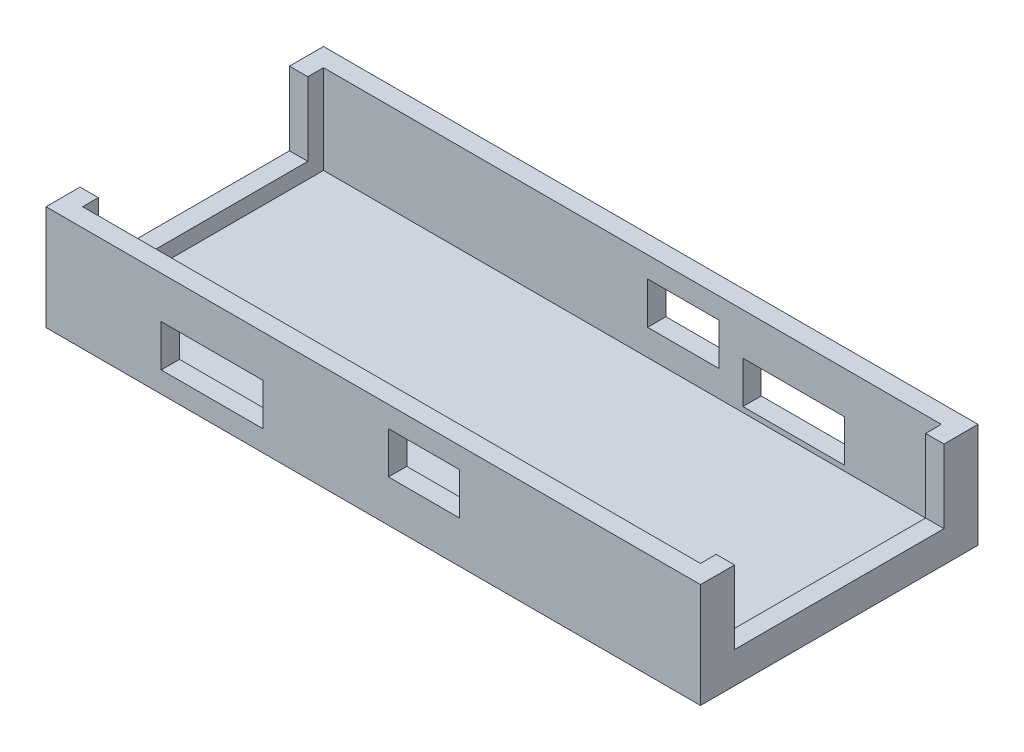
from build123d import *

# Parameters (mm, degrees)
CROQUIS1_W              = 62.5
CROQUIS1_H              = 26.5
SALIENTE_EXTRUIR1_DEPTH = 10
CORTAR_EXTRUIR1_START   = 10
CROQUIS2_W              = 59
CROQUIS2_H              = 23
CORTAR_EXTRUIR1_DEPTH   = 8.5
CORTAR_EXTRUIR4_START   = 13.25
CROQUIS6_W              = 6.8
CROQUIS6_H              = 4
CORTAR_EXTRUIR4_DEPTH   = 40
CORTAR_EXTRUIR5_START   = 13.25
CROQUIS7_W              = 9.7
CROQUIS7_H              = 4
CORTAR_EXTRUIR5_DEPTH   = 11
CROQUIS10_W             = 9.7
CROQUIS10_H             = 4
CORTAR_EXTRUIR6_DEPTH   = 11
CROQUIS11_W             = 14
CROQUIS11_H             = 11
SALIENTE_EXTRUIR2_DEPTH = 2
CROQUIS12_W             = 10
CROQUIS12_H             = 1.25
CORTAR_EXTRUIR7_DEPTH   = 22
REDONDEO1_R             = 0.5
CORTAR_EXTRUIR8_START   = 31.25
CROQUIS4_W              = 20
CROQUIS4_H              = 7
CORTAR_EXTRUIR8_DEPTH   = 10
CORTAR_EXTRUIR9_START   = -31.25
CROQUIS4_3_W            = 20
CROQUIS4_3_H            = 7
CORTAR_EXTRUIR9_DEPTH   = 10


with BuildPart() as part:
    # Croquis1 → Saliente-Extruir1 (new body)
    with BuildSketch(Plane(origin=(0, 0, 0), x_dir=(1, 0, 0), z_dir=(0, 1, 0))):
        Rectangle(CROQUIS1_W, CROQUIS1_H)
    extrude(amount=SALIENTE_EXTRUIR1_DEPTH)

    # Croquis2 → Cortar-Extruir1 (cut)
    with BuildSketch(Plane(origin=(0, 0, 0), x_dir=(1, 0, 0), z_dir=(0, 1, 0)).offset(CORTAR_EXTRUIR1_START)):
        Rectangle(CROQUIS2_W, CROQUIS2_H)
    extrude(amount=-CORTAR_EXTRUIR1_DEPTH, mode=Mode.SUBTRACT)

    # Croquis6 → Cortar-Extruir4 (cut)
    with BuildSketch(Plane.XY.offset(CORTAR_EXTRUIR4_START)):
        with Locations((4.85, 6)):
            Rectangle(CROQUIS6_W, CROQUIS6_H)
    extrude(amount=-CORTAR_EXTRUIR4_DEPTH, mode=Mode.SUBTRACT)

    # Croquis7 → Cortar-Extruir5 (cut)
    with BuildSketch(Plane.XY.offset(CORTAR_EXTRUIR5_START)):
        with Locations((-15.4, 4)):
            Rectangle(CROQUIS7_W, CROQUIS7_H)
    extrude(amount=-CORTAR_EXTRUIR5_DEPTH, mode=Mode.SUBTRACT)

    # Croquis10 → Cortar-Extruir6 (cut)
    with BuildSketch(Plane(origin=(0, 0, -13.25), x_dir=(-1, 0, 0), z_dir=(0, 0, -1))):
        with Locations((-15.4, 4)):
            Rectangle(CROQUIS10_W, CROQUIS10_H)
    extrude(amount=-CORTAR_EXTRUIR6_DEPTH, mode=Mode.SUBTRACT)

    # Croquis11 → Saliente-Extruir2 (add)
    with BuildSketch(Plane(origin=(0, 0, 0), x_dir=(-1, 0, 0), z_dir=(0, -1, 0))):
        with Locations((-14.25, 0)):
            Rectangle(CROQUIS11_W, CROQUIS11_H)
        with Locations((14.25, 0)):
            Rectangle(CROQUIS11_W, CROQUIS11_H)
    extrude(amount=SALIENTE_EXTRUIR2_DEPTH)

    # Croquis12 → Cortar-Extruir7 (cut)
    with BuildSketch(Plane(origin=(0, 0, -5.5), x_dir=(-1, 0, 0), z_dir=(0, 0, -1))):
        with Locations((14.25, -0.625)):
            Rectangle(CROQUIS12_W, CROQUIS12_H)
        with Locations((-14.25, -0.625)):
            Rectangle(CROQUIS12_W, CROQUIS12_H)
    extrude(amount=-CORTAR_EXTRUIR7_DEPTH, mode=Mode.SUBTRACT)

    # Redondeo1
    # the kernel refuses this fillet: 0.5 mm, written as the material it takes off along each edge
    with BuildSketch(Plane(origin=(7.75, -1.5, 5), x_dir=(-1, 0, 0), z_dir=(0, 0, 1))) as redondeo1_piece_1_section:
        Polygon((0, 0), (REDONDEO1_R, 0), (REDONDEO1_R, REDONDEO1_R), (0, REDONDEO1_R), align=None)
    redondeo1_piece_1 = extrude(amount=REDONDEO1_R, mode=Mode.PRIVATE)
    redondeo1_piece_1 = redondeo1_piece_1 - Plane(origin=(7.75, -1.5, 5), x_dir=(0.7071067811865475, 0.7071067811865475, 0), z_dir=(0, 0, 1)) * Sphere(REDONDEO1_R, mode=Mode.PRIVATE)
    add(redondeo1_piece_1, mode=Mode.SUBTRACT)
    with BuildSketch(Plane(origin=(7.75, -1.5, -5), x_dir=(0, -1, 0), z_dir=(-1, 0, 0))) as redondeo1_piece_2_section:
        Polygon((0, 0), (REDONDEO1_R, 0), (REDONDEO1_R, -REDONDEO1_R), (0, -REDONDEO1_R), align=None)
    redondeo1_piece_2 = extrude(amount=REDONDEO1_R, mode=Mode.PRIVATE)
    redondeo1_piece_2 = redondeo1_piece_2 - Plane(origin=(7.75, -1.5, -5), x_dir=(0, 0.7071067811865475, 0.7071067811865475), z_dir=(-1, 0, 0)) * Sphere(REDONDEO1_R, mode=Mode.PRIVATE)
    add(redondeo1_piece_2, mode=Mode.SUBTRACT)
    with BuildSketch(Plane(origin=(20.75, -1.5, -5), x_dir=(1, 0, 0), z_dir=(0, -1, 0))) as redondeo1_piece_3_section:
        Polygon((0, 0), (REDONDEO1_R, 0), (REDONDEO1_R, -REDONDEO1_R), (0, -REDONDEO1_R), align=None)
    redondeo1_piece_3 = extrude(amount=REDONDEO1_R, mode=Mode.PRIVATE)
    redondeo1_piece_3 = redondeo1_piece_3 - Plane(origin=(20.75, -1.5, -5), x_dir=(-0.7071067811865475, 0, 0.7071067811865475), z_dir=(0, -1, 0)) * Sphere(REDONDEO1_R, mode=Mode.PRIVATE)
    add(redondeo1_piece_3, mode=Mode.SUBTRACT)
    with BuildSketch(Plane(origin=(20.75, -1.5, 5), x_dir=(0, -1, 0), z_dir=(0, 0, 1))) as redondeo1_piece_4_section:
        Polygon((0, 0), (REDONDEO1_R, 0), (REDONDEO1_R, REDONDEO1_R), (0, REDONDEO1_R), align=None)
    redondeo1_piece_4 = extrude(amount=REDONDEO1_R, mode=Mode.PRIVATE)
    redondeo1_piece_4 = redondeo1_piece_4 - Plane(origin=(20.75, -1.5, 5), x_dir=(-0.7071067811865475, 0.7071067811865475, 0), z_dir=(0, 0, 1)) * Sphere(REDONDEO1_R, mode=Mode.PRIVATE)
    add(redondeo1_piece_4, mode=Mode.SUBTRACT)
    with BuildSketch(Plane(origin=(-20.75, -1.5, 5), x_dir=(-1, 0, 0), z_dir=(0, 0, 1))) as redondeo1_piece_5_section:
        Polygon((0, 0), (REDONDEO1_R, 0), (REDONDEO1_R, REDONDEO1_R), (0, REDONDEO1_R), align=None)
    redondeo1_piece_5 = extrude(amount=REDONDEO1_R, mode=Mode.PRIVATE)
    redondeo1_piece_5 = redondeo1_piece_5 - Plane(origin=(-20.75, -1.5, 5), x_dir=(0.7071067811865475, 0.7071067811865475, 0), z_dir=(0, 0, 1)) * Sphere(REDONDEO1_R, mode=Mode.PRIVATE)
    add(redondeo1_piece_5, mode=Mode.SUBTRACT)
    with BuildSketch(Plane(origin=(-20.75, -1.5, -5), x_dir=(0, -1, 0), z_dir=(-1, 0, 0))) as redondeo1_piece_6_section:
        Polygon((0, 0), (REDONDEO1_R, 0), (REDONDEO1_R, -REDONDEO1_R), (0, -REDONDEO1_R), align=None)
    redondeo1_piece_6 = extrude(amount=REDONDEO1_R, mode=Mode.PRIVATE)
    redondeo1_piece_6 = redondeo1_piece_6 - Plane(origin=(-20.75, -1.5, -5), x_dir=(0, 0.7071067811865475, 0.7071067811865475), z_dir=(-1, 0, 0)) * Sphere(REDONDEO1_R, mode=Mode.PRIVATE)
    add(redondeo1_piece_6, mode=Mode.SUBTRACT)
    with BuildSketch(Plane(origin=(-7.75, -1.5, -5), x_dir=(1, 0, 0), z_dir=(0, -1, 0))) as redondeo1_piece_7_section:
        Polygon((0, 0), (REDONDEO1_R, 0), (REDONDEO1_R, -REDONDEO1_R), (0, -REDONDEO1_R), align=None)
    redondeo1_piece_7 = extrude(amount=REDONDEO1_R, mode=Mode.PRIVATE)
    redondeo1_piece_7 = redondeo1_piece_7 - Plane(origin=(-7.75, -1.5, -5), x_dir=(-0.7071067811865475, 0, 0.7071067811865475), z_dir=(0, -1, 0)) * Sphere(REDONDEO1_R, mode=Mode.PRIVATE)
    add(redondeo1_piece_7, mode=Mode.SUBTRACT)
    with BuildSketch(Plane(origin=(-7.75, -1.5, 5), x_dir=(0, -1, 0), z_dir=(0, 0, 1))) as redondeo1_piece_8_section:
        Polygon((0, 0), (REDONDEO1_R, 0), (REDONDEO1_R, REDONDEO1_R), (0, REDONDEO1_R), align=None)
    redondeo1_piece_8 = extrude(amount=REDONDEO1_R, mode=Mode.PRIVATE)
    redondeo1_piece_8 = redondeo1_piece_8 - Plane(origin=(-7.75, -1.5, 5), x_dir=(-0.7071067811865475, 0.7071067811865475, 0), z_dir=(0, 0, 1)) * Sphere(REDONDEO1_R, mode=Mode.PRIVATE)
    add(redondeo1_piece_8, mode=Mode.SUBTRACT)
    with BuildSketch(Plane(origin=(7.25, 0, 5.5), x_dir=(0, 0, -1), z_dir=(0, -1, 0)), Plane(origin=(21.25, 0, -5.5), x_dir=(0, 0, 1), z_dir=(0, -1, 0)), Plane(origin=(-21.25, 0, 5.5), x_dir=(0, 0, -1), z_dir=(0, -1, 0)), Plane(origin=(-7.25, 0, -5.5), x_dir=(0, 0, 1), z_dir=(0, -1, 0))) as redondeo1_piece_9:
        with BuildLine():
            CenterArc((REDONDEO1_R, REDONDEO1_R), REDONDEO1_R, 180, 90)
            Line((0, REDONDEO1_R), (0, 0))
            Line((0, 0), (REDONDEO1_R, 0))
        make_face()
    extrude(amount=1.5, mode=Mode.SUBTRACT)
    with BuildSketch(Plane(origin=(7.25, 0, -5.5), x_dir=(0, 0, 1), z_dir=(0, -1, 0)), Plane(origin=(21.25, 0, 5.5), x_dir=(0, 0, -1), z_dir=(0, -1, 0)), Plane(origin=(-21.25, 0, -5.5), x_dir=(0, 0, 1), z_dir=(0, -1, 0)), Plane(origin=(-7.25, 0, 5.5), x_dir=(0, 0, -1), z_dir=(0, -1, 0))) as redondeo1_piece_10:
        with BuildLine():
            CenterArc((REDONDEO1_R, -REDONDEO1_R), REDONDEO1_R, 90, 90)
            Line((0, -REDONDEO1_R), (0, 0))
            Line((0, 0), (REDONDEO1_R, 0))
        make_face()
    extrude(amount=1.5, mode=Mode.SUBTRACT)
    with BuildSketch(Plane(origin=(7.25, -2, -5), x_dir=(0, 1, 0), z_dir=(0, 0, 1)), Plane(origin=(-21.25, -2, -5), x_dir=(0, 1, 0), z_dir=(0, 0, 1))) as redondeo1_piece_11:
        with BuildLine():
            CenterArc((REDONDEO1_R, -REDONDEO1_R), REDONDEO1_R, 90, 90)
            Line((0, -REDONDEO1_R), (0, 0))
            Line((0, 0), (REDONDEO1_R, 0))
        make_face()
    extrude(amount=10, mode=Mode.SUBTRACT)
    with BuildSketch(Plane(origin=(20.75, -2, -5.5), x_dir=(0, 0, 1), z_dir=(-1, 0, 0)), Plane(origin=(7.75, -2, 5.5), x_dir=(0, 0, -1), z_dir=(1, 0, 0)), Plane(origin=(-7.75, -2, -5.5), x_dir=(0, 0, 1), z_dir=(-1, 0, 0)), Plane(origin=(-20.75, -2, 5.5), x_dir=(0, 0, -1), z_dir=(1, 0, 0))) as redondeo1_piece_12:
        with BuildLine():
            CenterArc((REDONDEO1_R, REDONDEO1_R), REDONDEO1_R, 180, 90)
            Line((0, REDONDEO1_R), (0, 0))
            Line((0, 0), (REDONDEO1_R, 0))
        make_face()
    extrude(amount=13, mode=Mode.SUBTRACT)
    with BuildSketch(Plane(origin=(21.25, -2, 5), x_dir=(-1, 0, 0), z_dir=(0, 0, -1)), Plane(origin=(-7.25, -2, 5), x_dir=(-1, 0, 0), z_dir=(0, 0, -1)), Plane(origin=(-9.25, -1.25, 5.5), x_dir=(0, 0, -1), z_dir=(-1, 0, 0)), Plane(origin=(19.25, -1.25, 5.5), x_dir=(0, 0, -1), z_dir=(-1, 0, 0)), Plane(origin=(-19.25, -1.25, -5.5), x_dir=(0, 0, 1), z_dir=(1, 0, 0)), Plane(origin=(9.25, -1.25, -5.5), x_dir=(0, 0, 1), z_dir=(1, 0, 0))) as redondeo1_piece_13:
        with BuildLine():
            CenterArc((REDONDEO1_R, REDONDEO1_R), REDONDEO1_R, 180, 90)
            Line((0, REDONDEO1_R), (0, 0))
            Line((0, 0), (REDONDEO1_R, 0))
        make_face()
    extrude(amount=10, mode=Mode.SUBTRACT)
    with BuildSketch(Plane(origin=(-9.25, 0, 5.5), x_dir=(0, 0, -1), z_dir=(0, -1, 0)), Plane(origin=(-19.25, -1.25, 5.5), x_dir=(0, 0, -1), z_dir=(0, 1, 0)), Plane(origin=(19.25, 0, 5.5), x_dir=(0, 0, -1), z_dir=(0, -1, 0)), Plane(origin=(9.25, -1.25, 5.5), x_dir=(0, 0, -1), z_dir=(0, 1, 0)), Plane(origin=(-19.25, 0, -5.5), x_dir=(0, 0, 1), z_dir=(0, -1, 0)), Plane(origin=(9.25, 0, -5.5), x_dir=(0, 0, 1), z_dir=(0, -1, 0))) as redondeo1_piece_14:
        with BuildLine():
            CenterArc((REDONDEO1_R, REDONDEO1_R), REDONDEO1_R, 180, 90)
            Line((0, REDONDEO1_R), (0, 0))
            Line((0, 0), (REDONDEO1_R, 0))
        make_face()
    extrude(amount=1.25, mode=Mode.SUBTRACT)
    with BuildSketch(Plane(origin=(-9.25, -1.25, -5.5), x_dir=(1, 0, 0), z_dir=(0, 1, 0)), Plane(origin=(19.25, -1.25, -5.5), x_dir=(1, 0, 0), z_dir=(0, 1, 0))) as redondeo1_piece_15:
        with BuildLine():
            CenterArc((REDONDEO1_R, -REDONDEO1_R), REDONDEO1_R, 90, 90)
            Line((0, -REDONDEO1_R), (0, 0))
            Line((0, 0), (REDONDEO1_R, 0))
        make_face()
    extrude(amount=1.25, mode=Mode.SUBTRACT)
    with BuildSketch(Plane(origin=(-8, -1.25, 5.5), x_dir=(0, 0, -1), z_dir=(-1, 0, 0))) as redondeo1_piece_16a_section:
        with BuildLine():
            CenterArc((REDONDEO1_R, REDONDEO1_R), REDONDEO1_R, 180, 90)
            Line((0, REDONDEO1_R), (0, 0))
            Line((0, 0), (REDONDEO1_R, 0))
        make_face()
    redondeo1_piece_16a = extrude(amount=11.25, mode=Mode.PRIVATE)
    redondeo1_piece_16a = split(redondeo1_piece_16a, bisect_by=Plane(origin=(-9.25, -1.363197557, 5.386802443), z_dir=(1, 0, 0)), keep=Keep.TOP, mode=Mode.PRIVATE)
    with BuildSketch(Plane(origin=(-9.25, 0, 5.5), x_dir=(0, 0, -1), z_dir=(0, -1, 0))) as redondeo1_piece_16b_section:
        with BuildLine():
            CenterArc((REDONDEO1_R, REDONDEO1_R), REDONDEO1_R, 180, 90)
            Line((0, REDONDEO1_R), (0, 0))
            Line((0, 0), (REDONDEO1_R, 0))
        make_face()
    redondeo1_piece_16b = extrude(amount=2.5, mode=Mode.PRIVATE)
    redondeo1_piece_16b = split(redondeo1_piece_16b, bisect_by=Plane(origin=(-9.136802443, -1.25, 5.386802443), z_dir=(0, -1, 0)), keep=Keep.TOP, mode=Mode.PRIVATE)
    redondeo1_piece_16 = redondeo1_piece_16a & redondeo1_piece_16b
    add(redondeo1_piece_16, mode=Mode.SUBTRACT)
    with BuildSketch(Plane(origin=(-19.25, -2.5, 5.5), x_dir=(0, 0, -1), z_dir=(0, 1, 0))) as redondeo1_piece_17a_section:
        with BuildLine():
            CenterArc((REDONDEO1_R, REDONDEO1_R), REDONDEO1_R, 180, 90)
            Line((0, REDONDEO1_R), (0, 0))
            Line((0, 0), (REDONDEO1_R, 0))
        make_face()
    redondeo1_piece_17a = extrude(amount=2.5, mode=Mode.PRIVATE)
    redondeo1_piece_17a = split(redondeo1_piece_17a, bisect_by=Plane(origin=(-19.363197557, -1.25, 5.386802443), z_dir=(0, -1, 0)), keep=Keep.TOP, mode=Mode.PRIVATE)
    with BuildSketch(Plane(origin=(-9.25, -1.25, 5.5), x_dir=(0, 0, -1), z_dir=(-1, 0, 0))) as redondeo1_piece_17b_section:
        with BuildLine():
            CenterArc((REDONDEO1_R, REDONDEO1_R), REDONDEO1_R, 180, 90)
            Line((0, REDONDEO1_R), (0, 0))
            Line((0, 0), (REDONDEO1_R, 0))
        make_face()
    redondeo1_piece_17b = extrude(amount=11.25, mode=Mode.PRIVATE)
    redondeo1_piece_17b = split(redondeo1_piece_17b, bisect_by=Plane(origin=(-19.25, -1.363197557, 5.386802443), z_dir=(-1, 0, 0)), keep=Keep.TOP, mode=Mode.PRIVATE)
    redondeo1_piece_17 = redondeo1_piece_17a & redondeo1_piece_17b
    add(redondeo1_piece_17, mode=Mode.SUBTRACT)
    with BuildSketch(Plane(origin=(20.5, -1.25, 5.5), x_dir=(0, 0, -1), z_dir=(-1, 0, 0))) as redondeo1_piece_18a_section:
        with BuildLine():
            CenterArc((REDONDEO1_R, REDONDEO1_R), REDONDEO1_R, 180, 90)
            Line((0, REDONDEO1_R), (0, 0))
            Line((0, 0), (REDONDEO1_R, 0))
        make_face()
    redondeo1_piece_18a = extrude(amount=11.25, mode=Mode.PRIVATE)
    redondeo1_piece_18a = split(redondeo1_piece_18a, bisect_by=Plane(origin=(19.25, -1.363197557, 5.386802443), z_dir=(1, 0, 0)), keep=Keep.TOP, mode=Mode.PRIVATE)
    with BuildSketch(Plane(origin=(19.25, 0, 5.5), x_dir=(0, 0, -1), z_dir=(0, -1, 0))) as redondeo1_piece_18b_section:
        with BuildLine():
            CenterArc((REDONDEO1_R, REDONDEO1_R), REDONDEO1_R, 180, 90)
            Line((0, REDONDEO1_R), (0, 0))
            Line((0, 0), (REDONDEO1_R, 0))
        make_face()
    redondeo1_piece_18b = extrude(amount=2.5, mode=Mode.PRIVATE)
    redondeo1_piece_18b = split(redondeo1_piece_18b, bisect_by=Plane(origin=(19.363197557, -1.25, 5.386802443), z_dir=(0, -1, 0)), keep=Keep.TOP, mode=Mode.PRIVATE)
    redondeo1_piece_18 = redondeo1_piece_18a & redondeo1_piece_18b
    add(redondeo1_piece_18, mode=Mode.SUBTRACT)
    with BuildSketch(Plane(origin=(9.25, -2.5, 5.5), x_dir=(0, 0, -1), z_dir=(0, 1, 0))) as redondeo1_piece_19a_section:
        with BuildLine():
            CenterArc((REDONDEO1_R, REDONDEO1_R), REDONDEO1_R, 180, 90)
            Line((0, REDONDEO1_R), (0, 0))
            Line((0, 0), (REDONDEO1_R, 0))
        make_face()
    redondeo1_piece_19a = extrude(amount=2.5, mode=Mode.PRIVATE)
    redondeo1_piece_19a = split(redondeo1_piece_19a, bisect_by=Plane(origin=(9.136802443, -1.25, 5.386802443), z_dir=(0, -1, 0)), keep=Keep.TOP, mode=Mode.PRIVATE)
    with BuildSketch(Plane(origin=(19.25, -1.25, 5.5), x_dir=(0, 0, -1), z_dir=(-1, 0, 0))) as redondeo1_piece_19b_section:
        with BuildLine():
            CenterArc((REDONDEO1_R, REDONDEO1_R), REDONDEO1_R, 180, 90)
            Line((0, REDONDEO1_R), (0, 0))
            Line((0, 0), (REDONDEO1_R, 0))
        make_face()
    redondeo1_piece_19b = extrude(amount=11.25, mode=Mode.PRIVATE)
    redondeo1_piece_19b = split(redondeo1_piece_19b, bisect_by=Plane(origin=(9.25, -1.363197557, 5.386802443), z_dir=(-1, 0, 0)), keep=Keep.TOP, mode=Mode.PRIVATE)
    redondeo1_piece_19 = redondeo1_piece_19a & redondeo1_piece_19b
    add(redondeo1_piece_19, mode=Mode.SUBTRACT)
    with BuildSketch(Plane(origin=(-19.25, 0, -5.5), x_dir=(0, 0, 1), z_dir=(0, -1, 0))) as redondeo1_piece_20a_section:
        with BuildLine():
            CenterArc((REDONDEO1_R, REDONDEO1_R), REDONDEO1_R, 180, 90)
            Line((0, REDONDEO1_R), (0, 0))
            Line((0, 0), (REDONDEO1_R, 0))
        make_face()
    redondeo1_piece_20a = extrude(amount=2.5, mode=Mode.PRIVATE)
    redondeo1_piece_20a = split(redondeo1_piece_20a, bisect_by=Plane(origin=(-19.363197557, -1.25, -5.386802443), z_dir=(0, -1, 0)), keep=Keep.TOP, mode=Mode.PRIVATE)
    with BuildSketch(Plane(origin=(-20.5, -1.25, -5.5), x_dir=(0, 0, 1), z_dir=(1, 0, 0))) as redondeo1_piece_20b_section:
        with BuildLine():
            CenterArc((REDONDEO1_R, REDONDEO1_R), REDONDEO1_R, 180, 90)
            Line((0, REDONDEO1_R), (0, 0))
            Line((0, 0), (REDONDEO1_R, 0))
        make_face()
    redondeo1_piece_20b = extrude(amount=11.25, mode=Mode.PRIVATE)
    redondeo1_piece_20b = split(redondeo1_piece_20b, bisect_by=Plane(origin=(-19.25, -1.363197557, -5.386802443), z_dir=(-1, 0, 0)), keep=Keep.TOP, mode=Mode.PRIVATE)
    redondeo1_piece_20 = redondeo1_piece_20a & redondeo1_piece_20b
    add(redondeo1_piece_20, mode=Mode.SUBTRACT)
    with BuildSketch(Plane(origin=(-19.25, -1.25, -5.5), x_dir=(0, 0, 1), z_dir=(1, 0, 0))) as redondeo1_piece_21a_section:
        with BuildLine():
            CenterArc((REDONDEO1_R, REDONDEO1_R), REDONDEO1_R, 180, 90)
            Line((0, REDONDEO1_R), (0, 0))
            Line((0, 0), (REDONDEO1_R, 0))
        make_face()
    redondeo1_piece_21a = extrude(amount=11.25, mode=Mode.PRIVATE)
    redondeo1_piece_21a = split(redondeo1_piece_21a, bisect_by=Plane(origin=(-9.25, -1.363197557, -5.386802443), z_dir=(1, 0, 0)), keep=Keep.TOP, mode=Mode.PRIVATE)
    with BuildSketch(Plane(origin=(-9.25, -2.5, -5.5), x_dir=(1, 0, 0), z_dir=(0, 1, 0))) as redondeo1_piece_21b_section:
        with BuildLine():
            CenterArc((REDONDEO1_R, -REDONDEO1_R), REDONDEO1_R, 90, 90)
            Line((0, -REDONDEO1_R), (0, 0))
            Line((0, 0), (REDONDEO1_R, 0))
        make_face()
    redondeo1_piece_21b = extrude(amount=2.5, mode=Mode.PRIVATE)
    redondeo1_piece_21b = split(redondeo1_piece_21b, bisect_by=Plane(origin=(-9.136802443, -1.25, -5.386802443), z_dir=(0, -1, 0)), keep=Keep.TOP, mode=Mode.PRIVATE)
    redondeo1_piece_21 = redondeo1_piece_21a & redondeo1_piece_21b
    add(redondeo1_piece_21, mode=Mode.SUBTRACT)
    with BuildSketch(Plane(origin=(9.25, 0, -5.5), x_dir=(0, 0, 1), z_dir=(0, -1, 0))) as redondeo1_piece_22a_section:
        with BuildLine():
            CenterArc((REDONDEO1_R, REDONDEO1_R), REDONDEO1_R, 180, 90)
            Line((0, REDONDEO1_R), (0, 0))
            Line((0, 0), (REDONDEO1_R, 0))
        make_face()
    redondeo1_piece_22a = extrude(amount=2.5, mode=Mode.PRIVATE)
    redondeo1_piece_22a = split(redondeo1_piece_22a, bisect_by=Plane(origin=(9.136802443, -1.25, -5.386802443), z_dir=(0, -1, 0)), keep=Keep.TOP, mode=Mode.PRIVATE)
    with BuildSketch(Plane(origin=(8, -1.25, -5.5), x_dir=(0, 0, 1), z_dir=(1, 0, 0))) as redondeo1_piece_22b_section:
        with BuildLine():
            CenterArc((REDONDEO1_R, REDONDEO1_R), REDONDEO1_R, 180, 90)
            Line((0, REDONDEO1_R), (0, 0))
            Line((0, 0), (REDONDEO1_R, 0))
        make_face()
    redondeo1_piece_22b = extrude(amount=11.25, mode=Mode.PRIVATE)
    redondeo1_piece_22b = split(redondeo1_piece_22b, bisect_by=Plane(origin=(9.25, -1.363197557, -5.386802443), z_dir=(-1, 0, 0)), keep=Keep.TOP, mode=Mode.PRIVATE)
    redondeo1_piece_22 = redondeo1_piece_22a & redondeo1_piece_22b
    add(redondeo1_piece_22, mode=Mode.SUBTRACT)
    with BuildSketch(Plane(origin=(9.25, -1.25, -5.5), x_dir=(0, 0, 1), z_dir=(1, 0, 0))) as redondeo1_piece_23a_section:
        with BuildLine():
            CenterArc((REDONDEO1_R, REDONDEO1_R), REDONDEO1_R, 180, 90)
            Line((0, REDONDEO1_R), (0, 0))
            Line((0, 0), (REDONDEO1_R, 0))
        make_face()
    redondeo1_piece_23a = extrude(amount=11.25, mode=Mode.PRIVATE)
    redondeo1_piece_23a = split(redondeo1_piece_23a, bisect_by=Plane(origin=(19.25, -1.363197557, -5.386802443), z_dir=(1, 0, 0)), keep=Keep.TOP, mode=Mode.PRIVATE)
    with BuildSketch(Plane(origin=(19.25, -2.5, -5.5), x_dir=(1, 0, 0), z_dir=(0, 1, 0))) as redondeo1_piece_23b_section:
        with BuildLine():
            CenterArc((REDONDEO1_R, -REDONDEO1_R), REDONDEO1_R, 90, 90)
            Line((0, -REDONDEO1_R), (0, 0))
            Line((0, 0), (REDONDEO1_R, 0))
        make_face()
    redondeo1_piece_23b = extrude(amount=2.5, mode=Mode.PRIVATE)
    redondeo1_piece_23b = split(redondeo1_piece_23b, bisect_by=Plane(origin=(19.363197557, -1.25, -5.386802443), z_dir=(0, -1, 0)), keep=Keep.TOP, mode=Mode.PRIVATE)
    redondeo1_piece_23 = redondeo1_piece_23a & redondeo1_piece_23b
    add(redondeo1_piece_23, mode=Mode.SUBTRACT)
    # the kernel refuses this fillet: 0.5 mm, written as the material it adds along each edge
    with BuildSketch(Plane(origin=(7.25, 0, -5), x_dir=(-1, 0, 0), z_dir=(0, 0, 1)), Plane(origin=(21.25, 0, 5), x_dir=(1, 0, 0), z_dir=(0, 0, -1)), Plane(origin=(-21.25, 0, -5), x_dir=(-1, 0, 0), z_dir=(0, 0, 1)), Plane(origin=(-7.25, 0, 5), x_dir=(1, 0, 0), z_dir=(0, 0, -1)), Plane(origin=(-9.25, 0, -5), x_dir=(-1, 0, 0), z_dir=(0, 0, 1)), Plane(origin=(19.25, 0, -5), x_dir=(-1, 0, 0), z_dir=(0, 0, 1))) as redondeo1_2_piece_1:
        with BuildLine():
            CenterArc((REDONDEO1_R, REDONDEO1_R), REDONDEO1_R, 180, 90)
            Line((0, REDONDEO1_R), (0, 0))
            Line((0, 0), (REDONDEO1_R, 0))
        make_face()
    extrude(amount=10)
    with BuildSketch(Plane(origin=(8.75, 0, -5.5), x_dir=(0, 0, -1), z_dir=(-1, 0, 0)), Plane(origin=(19.75, 0, 5.5), x_dir=(0, 0, 1), z_dir=(1, 0, 0)), Plane(origin=(-19.75, 0, -5.5), x_dir=(0, 0, -1), z_dir=(-1, 0, 0)), Plane(origin=(-8.75, 0, 5.5), x_dir=(0, 0, 1), z_dir=(1, 0, 0)), Plane(origin=(-20.75, 0, 5.5), x_dir=(0, 0, 1), z_dir=(1, 0, 0)), Plane(origin=(-7.75, 0, -5.5), x_dir=(0, 0, -1), z_dir=(-1, 0, 0)), Plane(origin=(7.75, 0, 5.5), x_dir=(0, 0, 1), z_dir=(1, 0, 0)), Plane(origin=(20.75, 0, -5.5), x_dir=(0, 0, -1), z_dir=(-1, 0, 0))) as redondeo1_2_piece_2:
        with BuildLine():
            CenterArc((REDONDEO1_R, REDONDEO1_R), REDONDEO1_R, 180, 90)
            Line((0, REDONDEO1_R), (0, 0))
            Line((0, 0), (REDONDEO1_R, 0))
        make_face()
    extrude(amount=1)
    with BuildSketch(Plane(origin=(-19.25, 0, -5), x_dir=(1, 0, 0), z_dir=(0, 0, 1)), Plane(origin=(9.25, 0, -5), x_dir=(1, 0, 0), z_dir=(0, 0, 1))) as redondeo1_2_piece_3:
        with BuildLine():
            CenterArc((REDONDEO1_R, -REDONDEO1_R), REDONDEO1_R, 90, 90)
            Line((0, -REDONDEO1_R), (0, 0))
            Line((0, 0), (REDONDEO1_R, 0))
        make_face()
    extrude(amount=10)
    with BuildSketch(Plane(origin=(19.75, 0, -5), x_dir=(0, 0, -1), z_dir=(1, 0, 0))) as redondeo1_2_piece_4:
        with BuildLine():
            CenterArc((0.5 + REDONDEO1_R, -REDONDEO1_R), REDONDEO1_R, 90, 90)
            Line((0.5, -REDONDEO1_R), (0.5, 0))
            Line((0.5, 0), (0.5 + REDONDEO1_R, 0))
        make_face()
    revolve(axis=Axis((19.75, 0, -5), (0, 1, 0)), revolution_arc=90)
    with BuildSketch(Plane(origin=(19.75, 0, 5), x_dir=(-1, 0, 0), z_dir=(0, 0, -1))) as redondeo1_2_piece_5:
        with BuildLine():
            CenterArc((0.5 + REDONDEO1_R, -REDONDEO1_R), REDONDEO1_R, 90, 90)
            Line((0.5, -REDONDEO1_R), (0.5, 0))
            Line((0.5, 0), (0.5 + REDONDEO1_R, 0))
        make_face()
    revolve(axis=Axis((19.75, 0, 5), (0, 1, 0)), revolution_arc=90)
    with BuildSketch(Plane(origin=(8.75, 0, -5), x_dir=(1, 0, 0), z_dir=(0, 0, 1))) as redondeo1_2_piece_6:
        with BuildLine():
            CenterArc((0.5 + REDONDEO1_R, -REDONDEO1_R), REDONDEO1_R, 90, 90)
            Line((0.5, -REDONDEO1_R), (0.5, 0))
            Line((0.5, 0), (0.5 + REDONDEO1_R, 0))
        make_face()
    revolve(axis=Axis((8.75, 0, -5), (0, 1, 0)), revolution_arc=90)
    with BuildSketch(Plane(origin=(8.75, 0, 5), x_dir=(1, 0, 0), z_dir=(0, 0, -1))) as redondeo1_2_piece_7:
        with BuildLine():
            CenterArc((0.5 + REDONDEO1_R, REDONDEO1_R), REDONDEO1_R, 180, 90)
            Line((0.5, REDONDEO1_R), (0.5, 0))
            Line((0.5, 0), (0.5 + REDONDEO1_R, 0))
        make_face()
    revolve(axis=Axis((8.75, 0, 5), (0, -1, 0)), revolution_arc=90)
    with BuildSketch(Plane(origin=(-8.75, 0, -5), x_dir=(0, 0, -1), z_dir=(1, 0, 0))) as redondeo1_2_piece_8:
        with BuildLine():
            CenterArc((0.5 + REDONDEO1_R, -REDONDEO1_R), REDONDEO1_R, 90, 90)
            Line((0.5, -REDONDEO1_R), (0.5, 0))
            Line((0.5, 0), (0.5 + REDONDEO1_R, 0))
        make_face()
    revolve(axis=Axis((-8.75, 0, -5), (0, 1, 0)), revolution_arc=90)
    with BuildSketch(Plane(origin=(-8.75, 0, 5), x_dir=(-1, 0, 0), z_dir=(0, 0, -1))) as redondeo1_2_piece_9:
        with BuildLine():
            CenterArc((0.5 + REDONDEO1_R, -REDONDEO1_R), REDONDEO1_R, 90, 90)
            Line((0.5, -REDONDEO1_R), (0.5, 0))
            Line((0.5, 0), (0.5 + REDONDEO1_R, 0))
        make_face()
    revolve(axis=Axis((-8.75, 0, 5), (0, 1, 0)), revolution_arc=90)
    with BuildSketch(Plane(origin=(-19.75, 0, -5), x_dir=(1, 0, 0), z_dir=(0, 0, 1))) as redondeo1_2_piece_10:
        with BuildLine():
            CenterArc((0.5 + REDONDEO1_R, -REDONDEO1_R), REDONDEO1_R, 90, 90)
            Line((0.5, -REDONDEO1_R), (0.5, 0))
            Line((0.5, 0), (0.5 + REDONDEO1_R, 0))
        make_face()
    revolve(axis=Axis((-19.75, 0, -5), (0, 1, 0)), revolution_arc=90)
    with BuildSketch(Plane(origin=(-19.75, 0, 5), x_dir=(1, 0, 0), z_dir=(0, 0, -1))) as redondeo1_2_piece_11:
        with BuildLine():
            CenterArc((0.5 + REDONDEO1_R, REDONDEO1_R), REDONDEO1_R, 180, 90)
            Line((0.5, REDONDEO1_R), (0.5, 0))
            Line((0.5, 0), (0.5 + REDONDEO1_R, 0))
        make_face()
    revolve(axis=Axis((-19.75, 0, 5), (0, -1, 0)), revolution_arc=90)
    with BuildSketch(Plane(origin=(20.75, 0, -5), x_dir=(1, 0, 0), z_dir=(0, 0, 1))) as redondeo1_2_piece_12:
        with BuildLine():
            CenterArc((0.5 + REDONDEO1_R, -REDONDEO1_R), REDONDEO1_R, 90, 90)
            Line((0.5, -REDONDEO1_R), (0.5, 0))
            Line((0.5, 0), (0.5 + REDONDEO1_R, 0))
        make_face()
    revolve(axis=Axis((20.75, 0, -5), (0, 1, 0)), revolution_arc=90)
    with BuildSketch(Plane(origin=(7.75, 0, 5), x_dir=(-1, 0, 0), z_dir=(0, 0, -1))) as redondeo1_2_piece_13:
        with BuildLine():
            CenterArc((0.5 + REDONDEO1_R, -REDONDEO1_R), REDONDEO1_R, 90, 90)
            Line((0.5, -REDONDEO1_R), (0.5, 0))
            Line((0.5, 0), (0.5 + REDONDEO1_R, 0))
        make_face()
    revolve(axis=Axis((7.75, 0, 5), (0, 1, 0)), revolution_arc=90)
    with BuildSketch(Plane(origin=(-7.75, 0, -5), x_dir=(1, 0, 0), z_dir=(0, 0, 1))) as redondeo1_2_piece_14:
        with BuildLine():
            CenterArc((0.5 + REDONDEO1_R, -REDONDEO1_R), REDONDEO1_R, 90, 90)
            Line((0.5, -REDONDEO1_R), (0.5, 0))
            Line((0.5, 0), (0.5 + REDONDEO1_R, 0))
        make_face()
    revolve(axis=Axis((-7.75, 0, -5), (0, 1, 0)), revolution_arc=90)
    with BuildSketch(Plane(origin=(-20.75, 0, 5), x_dir=(-1, 0, 0), z_dir=(0, 0, -1))) as redondeo1_2_piece_15:
        with BuildLine():
            CenterArc((0.5 + REDONDEO1_R, -REDONDEO1_R), REDONDEO1_R, 90, 90)
            Line((0.5, -REDONDEO1_R), (0.5, 0))
            Line((0.5, 0), (0.5 + REDONDEO1_R, 0))
        make_face()
    revolve(axis=Axis((-20.75, 0, 5), (0, 1, 0)), revolution_arc=90)
    with BuildSketch(Plane(origin=(-7.75, 0, 5), x_dir=(1, 0, 0), z_dir=(0, 0, -1))) as redondeo1_2_piece_16:
        with BuildLine():
            CenterArc((0.5 + REDONDEO1_R, REDONDEO1_R), REDONDEO1_R, 180, 90)
            Line((0.5, REDONDEO1_R), (0.5, 0))
            Line((0.5, 0), (0.5 + REDONDEO1_R, 0))
        make_face()
    revolve(axis=Axis((-7.75, 0, 5), (0, -1, 0)), revolution_arc=90)
    with BuildSketch(Plane(origin=(-20.75, 0, -5), x_dir=(-1, 0, 0), z_dir=(0, 0, 1))) as redondeo1_2_piece_17:
        with BuildLine():
            CenterArc((0.5 + REDONDEO1_R, REDONDEO1_R), REDONDEO1_R, 180, 90)
            Line((0.5, REDONDEO1_R), (0.5, 0))
            Line((0.5, 0), (0.5 + REDONDEO1_R, 0))
        make_face()
    revolve(axis=Axis((-20.75, 0, -5), (0, -1, 0)), revolution_arc=90)
    with BuildSketch(Plane(origin=(20.75, 0, 5), x_dir=(1, 0, 0), z_dir=(0, 0, -1))) as redondeo1_2_piece_18:
        with BuildLine():
            CenterArc((0.5 + REDONDEO1_R, REDONDEO1_R), REDONDEO1_R, 180, 90)
            Line((0.5, REDONDEO1_R), (0.5, 0))
            Line((0.5, 0), (0.5 + REDONDEO1_R, 0))
        make_face()
    revolve(axis=Axis((20.75, 0, 5), (0, -1, 0)), revolution_arc=90)
    with BuildSketch(Plane(origin=(7.75, 0, -5), x_dir=(-1, 0, 0), z_dir=(0, 0, 1))) as redondeo1_2_piece_19:
        with BuildLine():
            CenterArc((0.5 + REDONDEO1_R, REDONDEO1_R), REDONDEO1_R, 180, 90)
            Line((0.5, REDONDEO1_R), (0.5, 0))
            Line((0.5, 0), (0.5 + REDONDEO1_R, 0))
        make_face()
    revolve(axis=Axis((7.75, 0, -5), (0, -1, 0)), revolution_arc=90)

    # Croquis4 → Cortar-Extruir8 (cut)
    with BuildSketch(Plane(origin=(0, 0, 0), x_dir=(0, 0, -1), z_dir=(1, 0, 0)).offset(CORTAR_EXTRUIR8_START)):
        with Locations((0, 6.5)):
            Rectangle(CROQUIS4_W, CROQUIS4_H)
    extrude(amount=-CORTAR_EXTRUIR8_DEPTH, mode=Mode.SUBTRACT)

    # Croquis4<3> → Cortar-Extruir9 (cut)
    with BuildSketch(Plane(origin=(0, 0, 0), x_dir=(0, 0, -1), z_dir=(1, 0, 0)).offset(CORTAR_EXTRUIR9_START)):
        with Locations((0, 6.5)):
            Rectangle(CROQUIS4_3_W, CROQUIS4_3_H)
    extrude(amount=CORTAR_EXTRUIR9_DEPTH, mode=Mode.SUBTRACT)


solid = part.part
